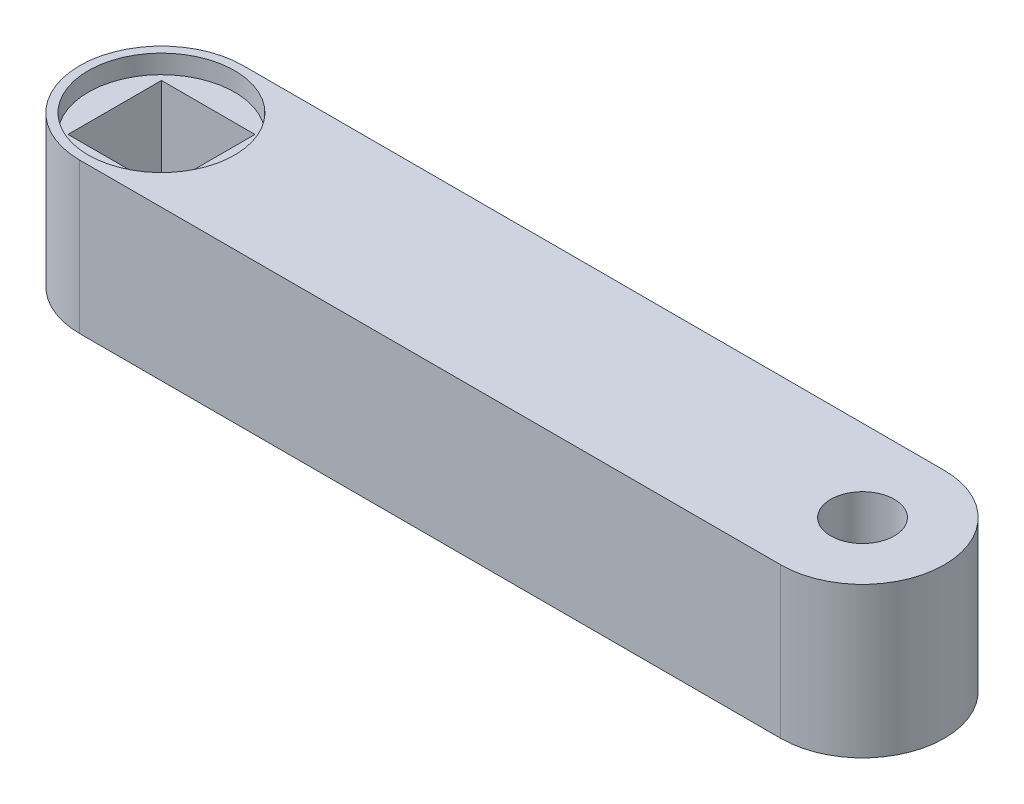
from build123d import *

# Parameters (mm, degrees)
BOSS_EXTRUDE1_DEPTH = 10.2108
SKETCH2_R           = 2.159
SKETCH2_W           = 6.35
SKETCH2_H           = 6.35
CUT_EXTRUDE1_DEPTH  = 55.436914886
SKETCH3_R           = 4.97205
CUT_EXTRUDE2_DEPTH  = 1.27


with BuildPart() as part:
    # Sketch1 → Boss-Extrude1 (new body)
    with BuildSketch(Plane(origin=(0, 0, 0), x_dir=(1, 0, 0), z_dir=(0, 1, 0))):
        with BuildLine():
            Line((0, 5.55625), (47.625, 5.55625))
            ThreePointArc((47.625, 5.55625), (53.18125, 0), (47.625, -5.55625))
            Line((47.625, -5.55625), (0, -5.55625))
            ThreePointArc((0, -5.55625), (-5.55625, 0), (0, 5.55625))
        make_face()
    extrude(amount=BOSS_EXTRUDE1_DEPTH)

    # Sketch2 → Cut-Extrude1 (cut, through all)
    with BuildSketch(Plane(origin=(0, 10.2108, 0), x_dir=(1, 0, 0), z_dir=(0, 1, 0))):
        with Locations((47.625, 0)):
            Circle(SKETCH2_R)
        Rectangle(SKETCH2_W, SKETCH2_H)
    extrude(amount=-CUT_EXTRUDE1_DEPTH, mode=Mode.SUBTRACT)

    # Sketch3 → Cut-Extrude2 (cut)
    with BuildSketch(Plane(origin=(0, 10.2108, 0), x_dir=(1, 0, 0), z_dir=(0, 1, 0))):
        Circle(SKETCH3_R)
    cut_extrude2 = extrude(amount=-CUT_EXTRUDE2_DEPTH, mode=Mode.SUBTRACT)

    # Mirror1: Cut-Extrude2 across plane
    add(cut_extrude2.mirror(Plane.ZX.offset(5.1054)), mode=Mode.SUBTRACT)


solid = part.part
